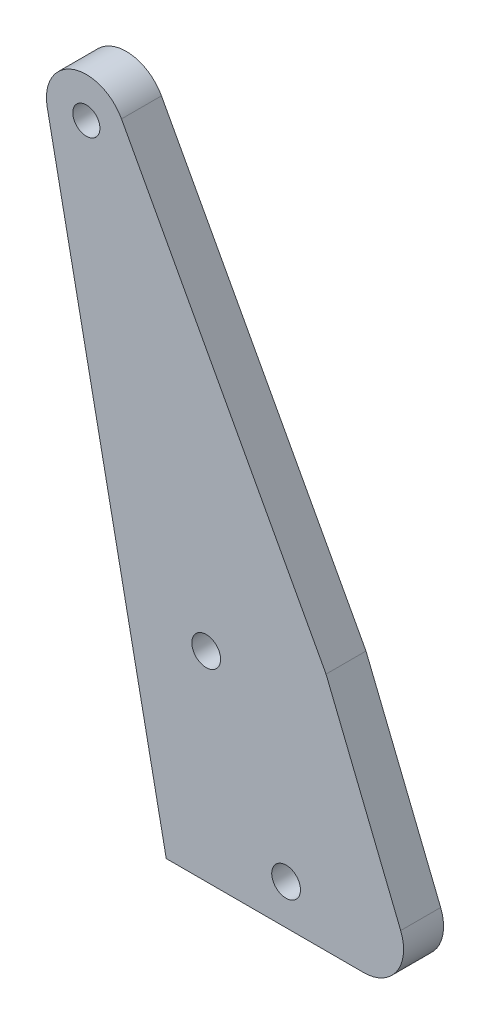
from build123d import *

# Parameters (mm, degrees)
SKETCH1_R           = 2.286
SKETCH1_R_2         = 2.159
BOSS_EXTRUDE1_DEPTH = 6.35
FILLET1_R           = 6.35


with BuildPart() as part:
    # Sketch1 → Boss-Extrude1 (new body)
    with BuildSketch(Plane.XY):
        with BuildLine():
            Line((0, 0), (-25.4, 0))
            Line((-25.4, 0), (-44.325080611, 93.996655919))
            ThreePointArc((-44.325080611, 93.996655919), (-40.259800646, 101.221411991), (-32.513467201, 98.268799644))
            Line((-32.513467201, 98.268799644), (0, 38.1))
            Line((0, 38.1), (15.393399204, 0))
            Line((15.393399204, 0), (0, 0))
        make_face()
        with Locations((-6.35, 6.35)):
            Circle(SKETCH1_R, mode=Mode.SUBTRACT)
        with Locations((-19.05, 31.75)):
            Circle(SKETCH1_R, mode=Mode.SUBTRACT)
        with Locations((-38.1, 95.25)):
            Circle(SKETCH1_R_2, mode=Mode.SUBTRACT)
    extrude(amount=-BOSS_EXTRUDE1_DEPTH)

    # Fillet1
    fillet1_edges = [part.edges().sort_by_distance(p)[0] for p in [
        (15.393399204, 0, -3.175),
    ]]
    fillet(fillet1_edges, radius=FILLET1_R)


solid = part.part
